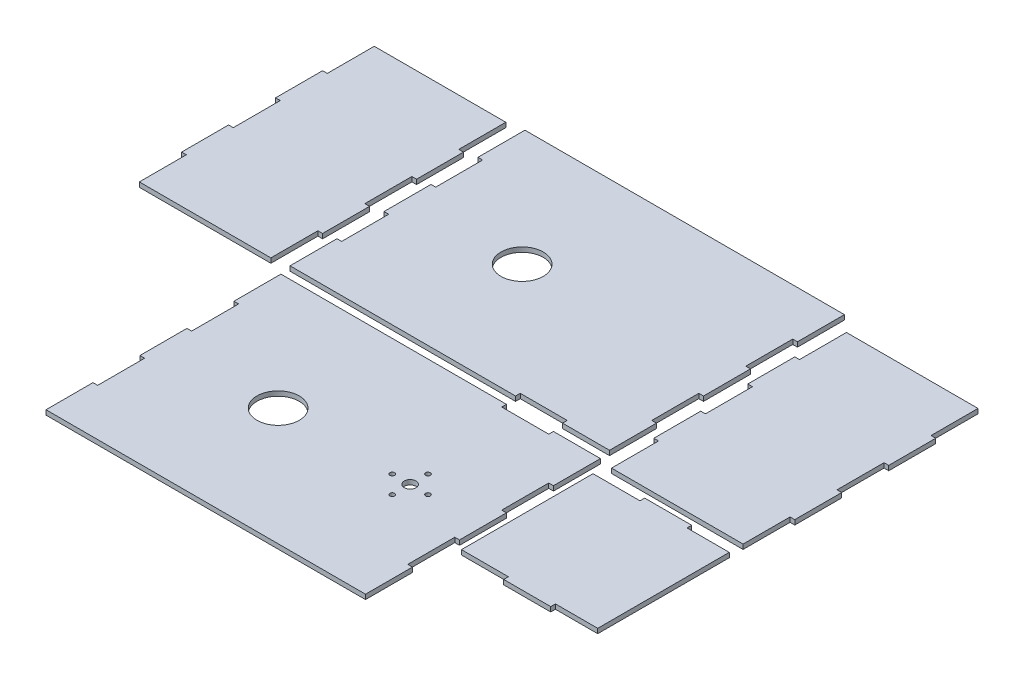
from build123d import *

# Parameters (mm, degrees)
SKETCH1_W                = 172.72
SKETCH1_H                = 127
BOSS_EXTRUDE1_DEPTH      = 2.54
SKETCH2_W                = 2.54
SKETCH2_H                = 25.4
CUT_EXTRUDE1_DEPTH       = 215.400676305
SKETCH3_W                = 2.54
SKETCH3_H                = 25.4
CUT_EXTRUDE2_DEPTH       = 215.400676305
SKETCH11_W               = 76.2
SKETCH11_H               = 127
BOSS_EXTRUDE7_DEPTH      = 2.54
SKETCH19_W               = 2.54
SKETCH19_H               = 25.4
CUT_EXTRUDE7_DEPTH       = 2.54
SKETCH20_W               = 76.2
SKETCH20_H               = 127
BOSS_EXTRUDE8_DEPTH      = 2.54
SKETCH21_W               = 2.54
SKETCH21_H               = 25.4
CUT_EXTRUDE8_DEPTH       = 2.54
SKETCH22_W               = 2.54
SKETCH22_H               = 25.4
CUT_EXTRUDE9_DEPTH       = 227.686995657
SKETCH24_W               = 172.72
SKETCH24_H               = 127
BOSS_EXTRUDE9_DEPTH      = 2.54
SKETCH25_W               = 2.54
SKETCH25_H               = 25.4
CUT_EXTRUDE11_DEPTH      = 2.54
SKETCH28_W               = 76.2
SKETCH28_H               = 76.2
BOSS_EXTRUDE10_DEPTH     = 2.54
SKETCH29_W               = 25.4
SKETCH29_H               = 2.54
CUT_EXTRUDE12_DEPTH      = 2.54
SKETCH30_W               = 25.4
SKETCH30_H               = 2.54
CUT_EXTRUDE13_DEPTH      = 2.54
CUT_EXTRUDE14_DEPTH      = 228.525028074
CUT_EXTRUDE14_DEPTH_BACK = 228.525028074
SKETCH31_W               = 25.4
SKETCH31_H               = 2.54
SKETCH32_W               = 25.4
SKETCH32_H               = 2.54
CUT_EXTRUDE15_DEPTH      = 228.525028074
SKETCH35_W               = 71.12
SKETCH35_H               = 2.54
CUT_EXTRUDE16_DEPTH      = 2.54
SKETCH36_R               = 11.43
CUT_EXTRUDE17_DEPTH      = 2.54
SKETCH37_R               = 3.175
CUT_EXTRUDE18_DEPTH      = 2.54
SKETCH38_R               = 1.27
CUT_EXTRUDE19_DEPTH      = 2.54
CIRPATTERN1_COUNT        = 4
CUT_EXTRUDE20_START      = -2.54
SKETCH44_R               = 11.43
CUT_EXTRUDE20_DEPTH      = 2.54
BODY_MOVE_COPY31_ANGLE   = 90
BODY_MOVE_COPY33_ANGLE   = 90
BODY_MOVE_COPY35_ANGLE   = 90
BODY_MOVE_COPY36_ANGLE   = 90
BODY_MOVE_COPY39_ANGLE   = 90
BODY_MOVE_COPY41_ANGLE   = 90


with BuildPart() as part:
    # Sketch1 → Boss-Extrude1 (new body)
    with BuildSketch(Plane.XY):
        with Locations((86.36, 63.5)):
            Rectangle(SKETCH1_W, SKETCH1_H)
    extrude(amount=BOSS_EXTRUDE1_DEPTH)

    # Sketch2 → Cut-Extrude1 (cut, through all)
    with BuildSketch(Plane(origin=(0, 0, 0), x_dir=(-1, 0, 0), z_dir=(0, 0, -1))):
        with Locations((-171.45, 88.9)):
            Rectangle(SKETCH2_W, SKETCH2_H)
        with Locations((-171.45, 38.1)):
            Rectangle(SKETCH2_W, SKETCH2_H)
    extrude(amount=-CUT_EXTRUDE1_DEPTH, mode=Mode.SUBTRACT)

    # Sketch3 → Cut-Extrude2 (cut, through all)
    with BuildSketch(Plane(origin=(0, 0, 0), x_dir=(-1, 0, 0), z_dir=(0, 0, -1))):
        with Locations((-1.27, 88.9)):
            Rectangle(SKETCH3_W, SKETCH3_H)
        with Locations((-1.27, 38.1)):
            Rectangle(SKETCH3_W, SKETCH3_H)
    extrude(amount=-CUT_EXTRUDE2_DEPTH, mode=Mode.SUBTRACT)

    # Sketch31 → Cut-Extrude14 (cut, two sides: drawn at the far end of the back side and taken through both)
    with BuildSketch(Plane.XY.offset(2.54).offset(-CUT_EXTRUDE14_DEPTH_BACK)):
        with Locations((134.62, 1.27)):
            Rectangle(SKETCH31_W, SKETCH31_H)
    extrude(amount=CUT_EXTRUDE14_DEPTH + CUT_EXTRUDE14_DEPTH_BACK, mode=Mode.SUBTRACT)

    # Sketch36 → Cut-Extrude17 (cut)
    with BuildSketch(Plane.XY.offset(2.54)):
        with Locations((61.976, 63.5)):
            Circle(SKETCH36_R)
    extrude(amount=-CUT_EXTRUDE17_DEPTH, mode=Mode.SUBTRACT)

    # Sketch37 → Cut-Extrude18 (cut)
    with BuildSketch(Plane.XY.offset(2.54)):
        with Locations((133.35, 63.5)):
            Circle(SKETCH37_R)
    extrude(amount=-CUT_EXTRUDE18_DEPTH, mode=Mode.SUBTRACT)

    # Sketch38 → Cut-Extrude19 (cut)
    with BuildSketch(Plane.XY.offset(2.54)):
        with Locations((123.698, 63.5)):
            Circle(SKETCH38_R)
    cut_extrude19 = extrude(amount=-CUT_EXTRUDE19_DEPTH, mode=Mode.SUBTRACT)

    # CirPattern1: Cut-Extrude19 ×4 about axis
    cirpattern1_axis = Axis((133.35, 63.5, 0), (0, 0, 1))
    for i in range(1, CIRPATTERN1_COUNT):
        add(cut_extrude19.rotate(cirpattern1_axis, i * 360 / CIRPATTERN1_COUNT), mode=Mode.SUBTRACT)


with BuildPart() as body_2:
    # Sketch11 → Boss-Extrude7 (new body)
    with BuildSketch(Plane.ZY):
        with Locations((-35.56, 63.5)):
            Rectangle(SKETCH11_W, SKETCH11_H)
    extrude(amount=BOSS_EXTRUDE7_DEPTH)

    # Sketch19 → Cut-Extrude7 (cut)
    with BuildSketch(Plane.ZY.offset(2.54)):
        with Locations((1.27, 114.3)):
            Rectangle(SKETCH19_W, SKETCH19_H)
        with Locations((1.27, 63.5)):
            Rectangle(SKETCH19_W, SKETCH19_H)
        with Locations((1.27, 12.7)):
            Rectangle(SKETCH19_W, SKETCH19_H)
    extrude(amount=-CUT_EXTRUDE7_DEPTH, mode=Mode.SUBTRACT)


with BuildPart() as body_2_1:
    # Body-Move/Copy1: read off the stored shape, not the designer's step
    # Body-Move/Copy1: moved
    add(body_2.part.moved(Location((172.72, 0, 0))))


with BuildPart() as body_3:
    # Sketch20 → Boss-Extrude8 (new body)
    with BuildSketch(Plane.ZY):
        with Locations((-35.56, 63.5)):
            Rectangle(SKETCH20_W, SKETCH20_H)
    extrude(amount=BOSS_EXTRUDE8_DEPTH)

    # Sketch21 → Cut-Extrude8 (cut)
    with BuildSketch(Plane.ZY.offset(2.54)):
        with Locations((1.27, 114.3)):
            Rectangle(SKETCH21_W, SKETCH21_H)
        with Locations((1.27, 63.5)):
            Rectangle(SKETCH21_W, SKETCH21_H)
        with Locations((1.27, 12.7)):
            Rectangle(SKETCH21_W, SKETCH21_H)
    extrude(amount=-CUT_EXTRUDE8_DEPTH, mode=Mode.SUBTRACT)


with BuildPart() as body_3_1:
    # Body-Move/Copy2: read off the stored shape, not the designer's step
    # Body-Move/Copy2: moved
    add(body_3.part.moved(Location((2.54, 0, 0))))


with BuildPart() as cut_extrude9_tool:
    # Sketch22 → Cut-Extrude9 (new, through all)
    with BuildSketch(Plane(origin=(172.72, 0, 0), x_dir=(0, 0, -1), z_dir=(1, 0, 0))):
        with Locations((72.39, 114.3)):
            Rectangle(SKETCH22_W, SKETCH22_H)
        with Locations((72.39, 63.5)):
            Rectangle(SKETCH22_W, SKETCH22_H)
        with Locations((72.39, 12.7)):
            Rectangle(SKETCH22_W, SKETCH22_H)
    extrude(amount=-CUT_EXTRUDE9_DEPTH)


with BuildPart() as body_2_2:
    add(body_2_1.part)

    # Cut-Extrude9: cut by cut_extrude9_tool
    add(cut_extrude9_tool.part, mode=Mode.SUBTRACT)


with BuildPart() as body_3_2:
    add(body_3_1.part)

    # Cut-Extrude9: cut by cut_extrude9_tool
    add(cut_extrude9_tool.part, mode=Mode.SUBTRACT)


with BuildPart() as body_4:
    # Sketch24 → Boss-Extrude9 (new body)
    with BuildSketch(Plane(origin=(0, 0, -73.66), x_dir=(-1, 0, 0), z_dir=(0, 0, -1))):
        with Locations((-86.36, 38.1)):
            Rectangle(SKETCH24_W, SKETCH24_H)
    extrude(amount=BOSS_EXTRUDE9_DEPTH)

    # Sketch25 → Cut-Extrude11 (cut)
    with BuildSketch(Plane(origin=(0, 0, -76.2), x_dir=(-1, 0, 0), z_dir=(0, 0, -1))):
        with Locations((-171.45, 12.7)):
            Rectangle(SKETCH25_W, SKETCH25_H)
        with Locations((-171.45, 63.5)):
            Rectangle(SKETCH25_W, SKETCH25_H)
        with Locations((-1.27, 63.5)):
            Rectangle(SKETCH25_W, SKETCH25_H)
        with Locations((-1.27, 12.7)):
            Rectangle(SKETCH25_W, SKETCH25_H)
    extrude(amount=-CUT_EXTRUDE11_DEPTH, mode=Mode.SUBTRACT)


with BuildPart() as body_4_1:
    # Body-Move/Copy4: read off the stored shape, not the designer's step
    # Body-Move/Copy4: moved
    add(body_4.part.moved(Location((0, 25.4, 0))))


with BuildPart() as body_4_2:
    # Body-Move/Copy5: read off the stored shape, not the designer's step
    # Body-Move/Copy5: moved
    add(body_4_1.part.moved(Location((0, 0, 2.54))))

    # Sketch32 → Cut-Extrude15 (cut, through all)
    with BuildSketch(Plane(origin=(0, 0, -73.66), x_dir=(-1, 0, 0), z_dir=(0, 0, -1))):
        with Locations((-134.62, 1.27)):
            Rectangle(SKETCH32_W, SKETCH32_H)
    extrude(amount=-CUT_EXTRUDE15_DEPTH, mode=Mode.SUBTRACT)

    # Sketch44 → Cut-Extrude20 (cut)
    with BuildSketch(Plane(origin=(0, 0, -73.66), x_dir=(-1, 0, 0), z_dir=(0, 0, -1)).offset(CUT_EXTRUDE20_START)):
        with Locations(Location((-61.976, 63.5, 0), (0, 0, 180))):
            Circle(SKETCH44_R)
    extrude(amount=CUT_EXTRUDE20_DEPTH, mode=Mode.SUBTRACT)


with BuildPart() as body_5:
    # Sketch28 → Boss-Extrude10 (new body)
    with BuildSketch(Plane(origin=(0, 0, 0), x_dir=(-1, 0, 0), z_dir=(0, -1, 0))):
        with Locations((-134.62, 35.56)):
            Rectangle(SKETCH28_W, SKETCH28_H)
    extrude(amount=BOSS_EXTRUDE10_DEPTH)

    # Sketch29 → Cut-Extrude12 (cut)
    with BuildSketch(Plane(origin=(0, 0, -73.66), x_dir=(-1, 0, 0), z_dir=(0, 0, -1))):
        with Locations((-160.02, -1.27)):
            Rectangle(SKETCH29_W, SKETCH29_H)
        with Locations((-109.22, -1.27)):
            Rectangle(SKETCH29_W, SKETCH29_H)
    extrude(amount=-CUT_EXTRUDE12_DEPTH, mode=Mode.SUBTRACT)

    # Sketch30 → Cut-Extrude13 (cut)
    with BuildSketch(Plane.XY.offset(2.54)):
        with Locations((109.22, -1.27)):
            Rectangle(SKETCH30_W, SKETCH30_H)
        with Locations((160.02, -1.27)):
            Rectangle(SKETCH30_W, SKETCH30_H)
    extrude(amount=-CUT_EXTRUDE13_DEPTH, mode=Mode.SUBTRACT)

    # Sketch35 → Cut-Extrude16 (cut)
    with BuildSketch(Plane(origin=(172.72, 0, 0), x_dir=(0, 0, -1), z_dir=(1, 0, 0))):
        with Locations((35.56, -1.27)):
            Rectangle(SKETCH35_W, SKETCH35_H)
    extrude(amount=-CUT_EXTRUDE16_DEPTH, mode=Mode.SUBTRACT)


with BuildPart() as body_5_1:
    # Body-Move/Copy6: read off the stored shape, not the designer's step
    # Body-Move/Copy6: moved
    add(body_5.part.moved(Location((0, 2.54, 0))))


with BuildPart() as body_4_3:
    # Body-Move/Copy31: moved
    add(body_4_2.part.rotate(Axis((0, 63.5, -72.39), (-1, 0, 0)), BODY_MOVE_COPY31_ANGLE))


with BuildPart() as body_4_4:
    # Body-Move/Copy32: moved
    add(body_4_3.part.moved(Location((0, 0, -78.925918228))))


with BuildPart() as part_1:
    # Body-Move/Copy33: moved
    add(part.part.rotate(Axis((0, 63.5, 1.27), (1, 0, 0)), BODY_MOVE_COPY33_ANGLE))


with BuildPart() as part_2:
    # Body-Move/Copy34: moved
    add(part_1.part.moved(Location((0, 0, 72.561038444))))


with BuildPart() as body_3_3:
    # Body-Move/Copy35: moved
    add(body_3_2.part.rotate(Axis((1.27, 63.5, 0), (0, 0, 1)), BODY_MOVE_COPY35_ANGLE))


with BuildPart() as body_2_3:
    # Body-Move/Copy36: moved
    add(body_2_2.part.rotate(Axis((171.45, 63.5, 0), (0, 0, -1)), BODY_MOVE_COPY36_ANGLE))


with BuildPart() as body_2_4:
    # Body-Move/Copy37: moved
    add(body_2_3.part.moved(Location((81.125082832, 0, 0))))


with BuildPart() as body_5_2:
    # Body-Move/Copy38: moved
    add(body_5_1.part.moved(Location((0, 63.5, 0))))


with BuildPart() as body_3_4:
    # Body-Move/Copy39: moved
    add(body_3_3.part.rotate(Axis((1.27, 0, -35.56), (0, -1, 0)), BODY_MOVE_COPY39_ANGLE))


with BuildPart() as body_3_5:
    # Body-Move/Copy40: moved
    add(body_3_4.part.moved(Location((-50.8, 0, -114.3))))


with BuildPart() as body_2_5:
    # Body-Move/Copy41: moved
    add(body_2_4.part.rotate(Axis((252.575082832, 0, -35.56), (0, 1, 0)), BODY_MOVE_COPY41_ANGLE))


with BuildPart() as body_2_6:
    # Body-Move/Copy42: moved
    add(body_2_5.part.moved(Location((-25.4, 0, -114.3))))


with BuildPart() as body_5_3:
    # Body-Move/Copy43: moved
    add(body_5_2.part.moved(Location((93.98, 0, 0))))


with BuildPart() as part_3:
    # Body-Move/Copy44: moved
    add(part_2.part.moved(Location((0, 0, -81.28))))


with BuildPart() as part_4:
    # Body-Move/Copy45: read off the stored shape, not the designer's step
    # Body-Move/Copy45: moved
    add(part_3.part.moved(Location((11.43, 0, -10.5169567))))


with BuildPart() as body_4_5:
    # Body-Move/Copy46: read off the stored shape, not the designer's step
    # Body-Move/Copy46: moved
    add(body_4_4.part.moved(Location((10.0050828, 0, 0))))


with BuildPart() as body_2_7:
    # Body-Move/Copy47: read off the stored shape, not the designer's step
    # Body-Move/Copy47: moved
    add(body_2_6.part.moved(Location((0, 0, 6.35))))


with BuildPart() as body_3_6:
    # Body-Move/Copy48: read off the stored shape, not the designer's step
    # Body-Move/Copy48: moved
    add(body_3_5.part.moved(Location((15.0850828, 0, 0))))


solid = Compound([body_5_3.part, part_4.part, body_4_5.part, body_2_7.part, body_3_6.part])
